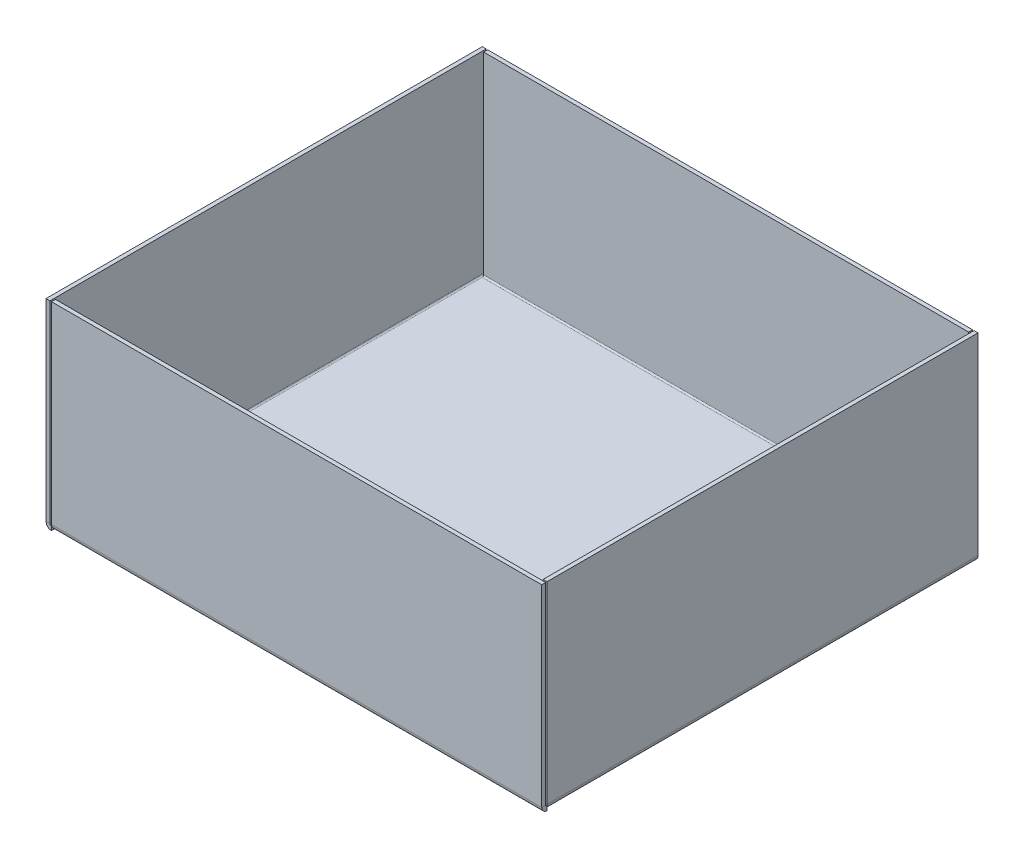
from build123d import *

# Parameters (mm, degrees)
SKETCH_1_W                       = 250
SKETCH_1_H                       = 220
SM_BASE_FLANGE_1_DEPTH           = 2
SM_EDGE_FLANGE_1_STRIP_W         = 9.4732
SM_EDGE_FLANGE_1_STRIP_H         = 2
SM_EDGE_FLANGE_1_STRIP_CUT_DEPTH = 220
SM_EDGE_FLANGE_1_DEPTH           = 220
SM_EDGE_FLANGE_2_STRIP_W         = 9.4732
SM_EDGE_FLANGE_2_STRIP_H         = 2
SM_EDGE_FLANGE_2_STRIP_CUT_DEPTH = 247.2634
SM_EDGE_FLANGE_2_DEPTH           = 247.2634
SM_EDGE_FLANGE_3_STRIP_W         = 9.4732
SM_EDGE_FLANGE_3_STRIP_H         = 2
SM_EDGE_FLANGE_3_STRIP_CUT_DEPTH = 217.2634
SM_EDGE_FLANGE_3_DEPTH           = 217.2634
SM_EDGE_FLANGE_4_STRIP_W         = 9.4732
SM_EDGE_FLANGE_4_STRIP_H         = 2
SM_EDGE_FLANGE_4_STRIP_CUT_DEPTH = 244.5268
SM_EDGE_FLANGE_4_DEPTH           = 244.5268


# Sheet-metal steps are written as plain solids
with BuildPart() as part:
    # Sketch 1 → 基体-法兰1 (new body)
    with BuildSketch(Plane(origin=(0, 0, 0), x_dir=(1, 0, 0), z_dir=(0, 1, 0))):
        Rectangle(SKETCH_1_W, SKETCH_1_H)
    extrude(amount=-SM_BASE_FLANGE_1_DEPTH)

    # 边线-法兰1 strip (across the edge) → 边线-法兰1 strip cut (cut)
    with BuildSketch(Plane(origin=(-125, 0, -110), x_dir=(1, 0, 0), z_dir=(0, 0, 1))):
        with Locations((-2, -1)):
            Rectangle(SM_EDGE_FLANGE_1_STRIP_W, SM_EDGE_FLANGE_1_STRIP_H)
    extrude(amount=SM_EDGE_FLANGE_1_STRIP_CUT_DEPTH, mode=Mode.SUBTRACT)

    # 边线-法兰1 section (across the edge) → 边线-法兰1 (add)
    with BuildSketch(Plane(origin=(-125, 0, -110), x_dir=(1, 0, 0), z_dir=(0, 0, 1))):
        with BuildLine():
            Line((0, 0.7366), (0, 98))
            Line((0, 98), (2, 98))
            Line((2, 98), (2, 0.7366))
            ThreePointArc((2, 0.7366), (2.215745145, 0.215745145), (2.7366, 0))
            Line((2.7366, 0), (2.7366, -2))
            ThreePointArc((2.7366, -2), (0.801531583, -1.198468417), (0, 0.7366))
        make_face()
    extrude(amount=SM_EDGE_FLANGE_1_DEPTH)

    # 边线-法兰2 strip (across the edge) → 边线-法兰2 strip cut (cut)
    with BuildSketch(Plane(origin=(-122.2634, 0, 110), x_dir=(0, 0, -1), z_dir=(1, 0, 0))):
        with Locations((-2, -1)):
            Rectangle(SM_EDGE_FLANGE_2_STRIP_W, SM_EDGE_FLANGE_2_STRIP_H)
    extrude(amount=SM_EDGE_FLANGE_2_STRIP_CUT_DEPTH, mode=Mode.SUBTRACT)

    # 边线-法兰2 section (across the edge) → 边线-法兰2 (add)
    with BuildSketch(Plane(origin=(-122.2634, 0, 110), x_dir=(0, 0, -1), z_dir=(1, 0, 0))):
        with BuildLine():
            Line((0, 0.7366), (0, 98))
            Line((0, 98), (2, 98))
            Line((2, 98), (2, 0.7366))
            ThreePointArc((2, 0.7366), (2.215745145, 0.215745145), (2.7366, 0))
            Line((2.7366, 0), (2.7366, -2))
            ThreePointArc((2.7366, -2), (0.801531583, -1.198468417), (0, 0.7366))
        make_face()
    extrude(amount=SM_EDGE_FLANGE_2_DEPTH)

    # 边线-法兰3 strip (across the edge) → 边线-法兰3 strip cut (cut)
    with BuildSketch(Plane(origin=(125, 0, 107.2634), x_dir=(-1, 0, 0), z_dir=(0, 0, -1))):
        with Locations((-2, -1)):
            Rectangle(SM_EDGE_FLANGE_3_STRIP_W, SM_EDGE_FLANGE_3_STRIP_H)
    extrude(amount=SM_EDGE_FLANGE_3_STRIP_CUT_DEPTH, mode=Mode.SUBTRACT)

    # 边线-法兰3 section (across the edge) → 边线-法兰3 (add)
    with BuildSketch(Plane(origin=(125, 0, 107.2634), x_dir=(-1, 0, 0), z_dir=(0, 0, -1))):
        with BuildLine():
            Line((0, 0.7366), (0, 98))
            Line((0, 98), (2, 98))
            Line((2, 98), (2, 0.7366))
            ThreePointArc((2, 0.7366), (2.215745145, 0.215745145), (2.7366, 0))
            Line((2.7366, 0), (2.7366, -2))
            ThreePointArc((2.7366, -2), (0.801531583, -1.198468417), (0, 0.7366))
        make_face()
    extrude(amount=SM_EDGE_FLANGE_3_DEPTH)

    # 边线-法兰4 strip (across the edge) → 边线-法兰4 strip cut (cut)
    with BuildSketch(Plane(origin=(122.2634, 0, -110), x_dir=(0, 0, 1), z_dir=(-1, 0, 0))):
        with Locations((-2, -1)):
            Rectangle(SM_EDGE_FLANGE_4_STRIP_W, SM_EDGE_FLANGE_4_STRIP_H)
    extrude(amount=SM_EDGE_FLANGE_4_STRIP_CUT_DEPTH, mode=Mode.SUBTRACT)

    # 边线-法兰4 section (across the edge) → 边线-法兰4 (add)
    with BuildSketch(Plane(origin=(122.2634, 0, -110), x_dir=(0, 0, 1), z_dir=(-1, 0, 0))):
        with BuildLine():
            Line((0, 0.7366), (0, 98))
            Line((0, 98), (2, 98))
            Line((2, 98), (2, 0.7366))
            ThreePointArc((2, 0.7366), (2.215745145, 0.215745145), (2.7366, 0))
            Line((2.7366, 0), (2.7366, -2))
            ThreePointArc((2.7366, -2), (0.801531583, -1.198468417), (0, 0.7366))
        make_face()
    extrude(amount=SM_EDGE_FLANGE_4_DEPTH)


solid = part.part
